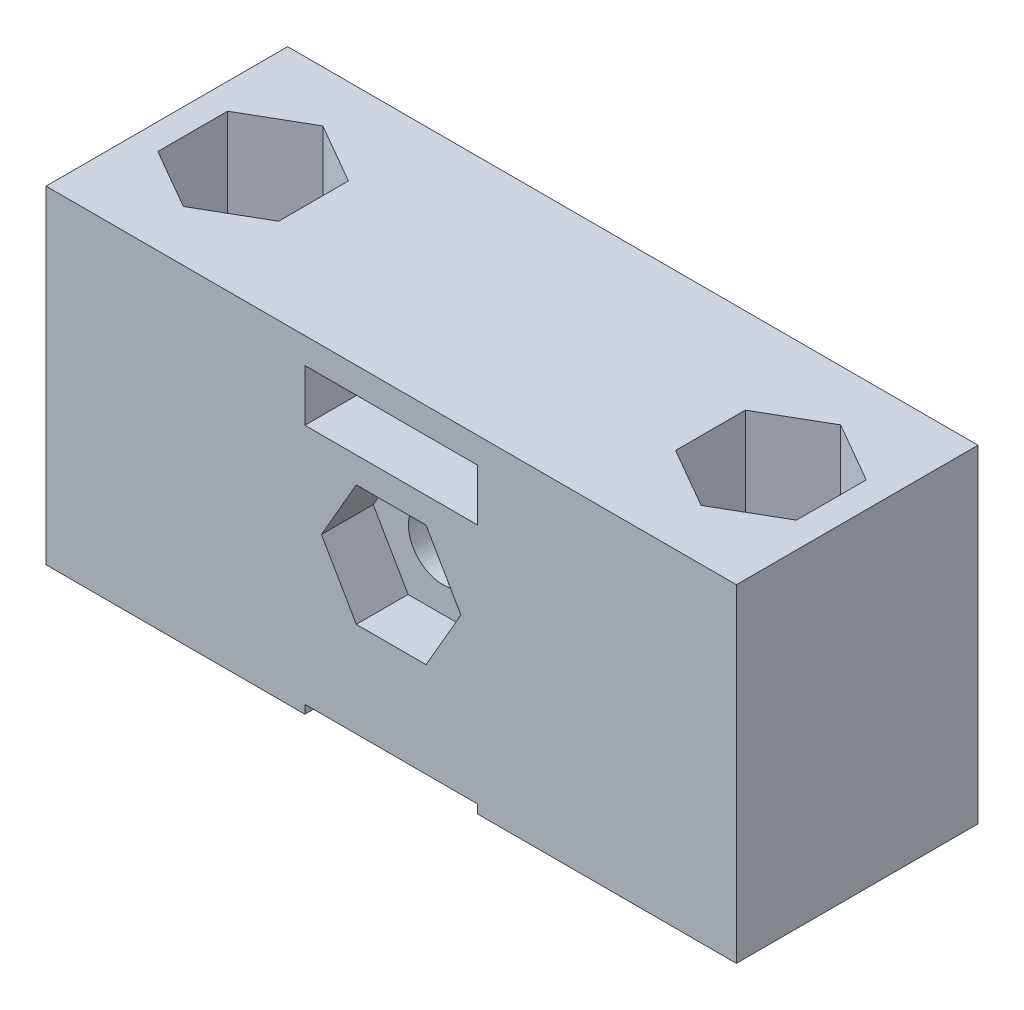
from build123d import *

# Parameters (mm, degrees)
SKETCH1_W           = 40
SKETCH1_H           = 14
BOSS_EXTRUDE1_DEPTH = 19
SKETCH2_W           = 10
SKETCH2_H           = 3
SKETCH2_H_2         = 1
CUT_EXTRUDE1_DEPTH  = 30
SKETCH3_R           = 2
CUT_EXTRUDE2_DEPTH  = 31.935416597
SKETCH4_R           = 1.6
CUT_EXTRUDE3_DEPTH  = 29.460498942
CUT_EXTRUDE4_DEPTH  = 10
CUT_EXTRUDE5_DEPTH  = 3


with BuildPart() as part:
    # Sketch1 → Boss-Extrude1 (new body)
    with BuildSketch(Plane(origin=(0, 0, 0), x_dir=(1, 0, 0), z_dir=(0, 1, 0))):
        Rectangle(SKETCH1_W, SKETCH1_H)
    extrude(amount=BOSS_EXTRUDE1_DEPTH)

    # Sketch2 → Cut-Extrude1 (cut)
    with BuildSketch(Plane.XY.offset(7)):
        with Locations((0, 16)):
            Rectangle(SKETCH2_W, SKETCH2_H)
        Rectangle(SKETCH2_W, SKETCH2_H_2)
    extrude(amount=-CUT_EXTRUDE1_DEPTH, mode=Mode.SUBTRACT)

    # Sketch3 → Cut-Extrude2 (cut, through all)
    with BuildSketch(Plane.XY.offset(7)):
        with Locations((0, 9.5)):
            Circle(SKETCH3_R)
    extrude(amount=-CUT_EXTRUDE2_DEPTH, mode=Mode.SUBTRACT)

    # Sketch4 → Cut-Extrude3 (cut, through all)
    with BuildSketch(Plane(origin=(0, 19, 0), x_dir=(1, 0, 0), z_dir=(0, 1, 0))):
        with Locations((-15, 0)):
            Circle(SKETCH4_R)
        with Locations((15, 0)):
            Circle(SKETCH4_R)
    extrude(amount=-CUT_EXTRUDE3_DEPTH, mode=Mode.SUBTRACT)

    # Sketch9 → Cut-Extrude4 (cut)
    with BuildSketch(Plane(origin=(0, 19, 0), x_dir=(1, 0, 0), z_dir=(0, 1, 0))):
        Polygon((-15, 4.041451884), (-18.5, 2.020725942), (-18.5, -2.020725942), (-15, -4.041451884), (-11.5, -2.020725942), (-11.5, 2.020725942), align=None)
        Polygon((11.5, 2.020725942), (15, 4.041451884), (18.5, 2.020725942), (18.5, -2.020725942), (15, -4.041451884), (11.5, -2.020725942), align=None)
    extrude(amount=-CUT_EXTRUDE4_DEPTH, mode=Mode.SUBTRACT)

    # Sketch10 → Cut-Extrude5 (cut)
    with BuildSketch(Plane.XY.offset(7)):
        Polygon((2.020725942, 13), (-2.020725942, 13), (-4.041451884, 9.5), (-2.020725942, 6), (2.020725942, 6), (4.041451884, 9.5), align=None)
    extrude(amount=-CUT_EXTRUDE5_DEPTH, mode=Mode.SUBTRACT)


solid = part.part
